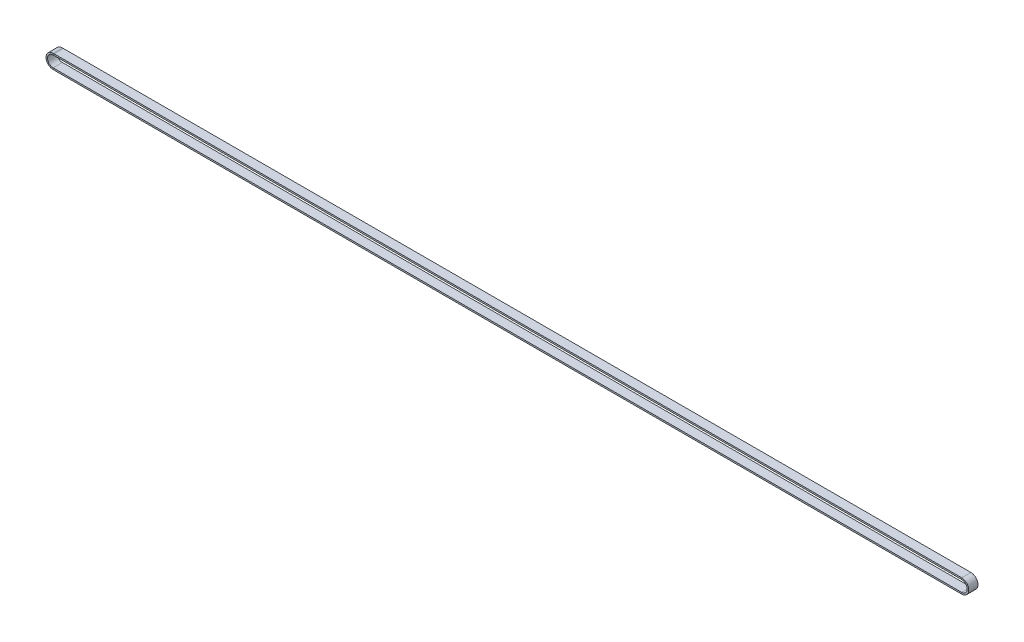
from build123d import *

# Parameters (mm, degrees)
SKETCH3_W = 9
SKETCH3_H = 1.5


with BuildPart() as part:
    # Sweep1: sweep along a path in Sketch2
    with BuildLine(Plane.XY) as sweep1_path:
        Line((-1, -15.927368837), (883.52063792, -15.927368837))
        ThreePointArc((883.52063792, -15.927368837), (890.42063792, -22.827368837), (883.52063792, -29.727368837))
        Line((883.52063792, -29.727368837), (-1, -29.727368837))
        ThreePointArc((-1, -29.727368837), (-7.9, -22.827368837), (-1, -15.927368837))
    # Sketch3 → Sweep1 (sweep)
    with BuildSketch(Plane(origin=(0, 0, 0), x_dir=(0, 0, -1), z_dir=(1, 0, 0))):
        with Locations((-4.5, -16.677368837)):
            Rectangle(SKETCH3_W, SKETCH3_H)
    sweep(path=sweep1_path.line)


solid = part.part
